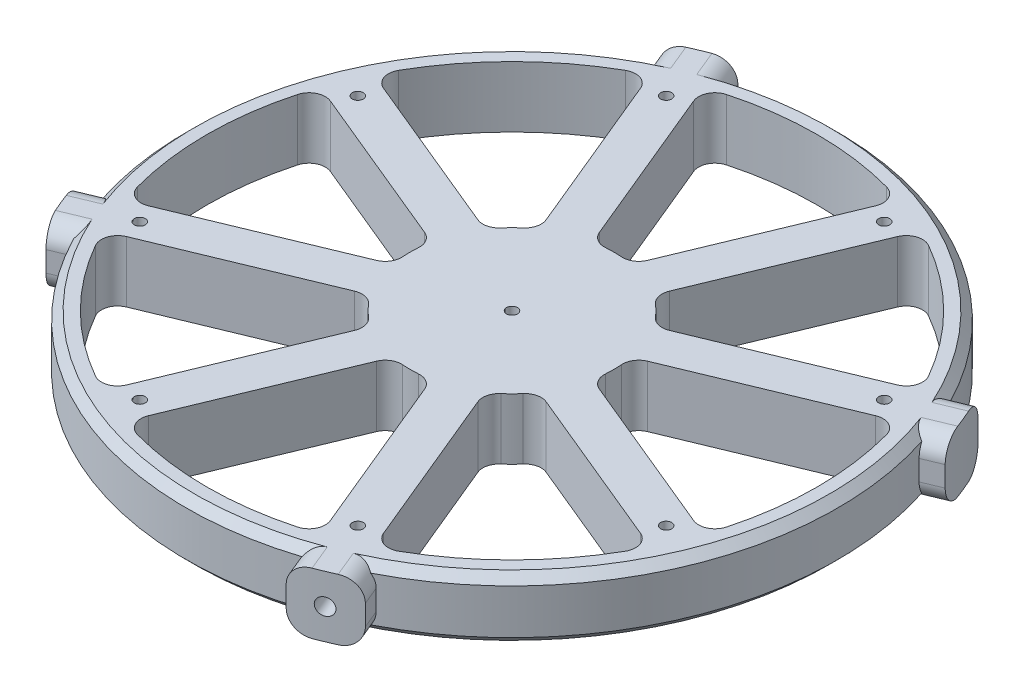
from build123d import *

# Parameters (mm, degrees)
F_6_32_TAPPED_HOLE2_D    = 2.7051
CIRPATTERN3_COUNT        = 8
CUT_EXTRUDE1_DEPTH       = 115.12688377441049
FILLET1_R                = 4
CIRPATTERN4_COUNT        = 8
FILLET1_OF_CIRPATTERN4_R = 4
F_6_32_TAPPED_HOLE1_D    = 2.7051
BOSS_EXTRUDE1_DEPTH      = 15
FILLET2_R                = 5
CIRPATTERN5_COUNT        = 4
FILLET2_OF_CIRPATTERN5_R = 5
CHAMFER1_SIZE            = 2


with BuildPart() as part:
    # Sketch2 → Revolve1 (revolve)
    with BuildSketch(Plane(origin=(0, 0, 0), x_dir=(0, 0, -1), z_dir=(1, 0, 0))):
        Polygon((0, 0), (-79.99983, -9.8e-15), (-79.99983, 14.99999999999999), (0, 14.99999999999999), align=None)
    revolve(axis=Axis((0, -0.7500000000000007, 0), (0, 1, 0)))

    # #6-32 Tapped Hole2 (through all)
    with Locations(Plane(origin=(0, 14.99999999999999, 0), x_dir=(1, 0, 0), z_dir=(0, 1, 0))):
        with Locations((-26.787840266, 64.671567276)):
            f_6_32_tapped_hole2 = Hole(F_6_32_TAPPED_HOLE2_D / 2)

    # CirPattern3: #6-32 Tapped Hole2 ×8 about axis
    cirpattern3_axis = Axis((0, -0.7500000000000007, 0), (0, 1, 0))
    for i in range(1, CIRPATTERN3_COUNT):
        add(f_6_32_tapped_hole2.rotate(cirpattern3_axis, i * 360 / CIRPATTERN3_COUNT), mode=Mode.SUBTRACT)

    # Sketch8 → Cut-Extrude1 (cut, through all)
    with BuildSketch(Plane(origin=(0, 14.99999999999999, 0), x_dir=(1, 0, 0), z_dir=(0, 1, 0))):
        with BuildLine():
            Line((-4.7543937605570585, 24.54375154636259), (-24.017942966303664, 71.05007329831746))
            ThreePointArc((-24.017942966303664, 71.05007329831746), (4.59e-15, 74.99982999999999), (24.017942966303664, 71.05007329831746))
            Line((24.017942966303664, 71.05007329831746), (4.7543937605570585, 24.54375154636259))
            ThreePointArc((4.7543937605570585, 24.54375154636259), (1.53e-15, 24.999999999999996), (-4.7543937605570585, 24.54375154636259))
        make_face()
    cut_extrude1 = extrude(amount=-CUT_EXTRUDE1_DEPTH, mode=Mode.SUBTRACT)

    # Fillet1
    fillet1_edges = [part.edges().sort_by_distance(p)[0] for p in [
        (4.754393760557059, 7.499999999999995, -24.543751546362593),
        (24.01794296630367, 7.499999999999995, -71.05007329831744),
        (-4.754393760557059, 7.499999999999995, -24.543751546362593),
        (-24.017942966303664, 7.499999999999995, -71.05007329831744),
    ]]
    fillet(fillet1_edges, radius=FILLET1_R)

    # CirPattern4: Cut-Extrude1 ×8 about axis
    cirpattern4_axis = Axis((0, -0.7500000000000007, 0), (0, 1, 0))
    for i in range(1, CIRPATTERN4_COUNT):
        add(cut_extrude1.rotate(cirpattern4_axis, i * 360 / CIRPATTERN4_COUNT), mode=Mode.SUBTRACT)

    # Fillet1 of CirPattern4
    fillet1_of_cirpattern4_edges = [part.edges().sort_by_distance(p)[0] for p in [
        (-13.99318908566989, 7.499999999999995, -20.71691722271171),
        (-33.25673829141644, 7.499999999999995, -67.22323897466659),
        (-20.716917222711707, 7.499999999999995, -13.993189085669895),
        (-67.22323897466657, 7.499999999999995, -33.256738291416454),
        (-24.543751546362593, 7.499999999999995, -4.754393760557061),
        (-71.05007329831744, 7.499999999999995, -24.017942966303675),
        (-24.543751546362593, 7.499999999999995, 4.754393760557058),
        (-71.05007329831744, 7.499999999999995, 24.01794296630366),
        (-20.71691722271171, 7.499999999999995, 13.99318908566989),
        (-67.22323897466659, 7.499999999999995, 33.25673829141644),
        (-13.993189085669895, 7.499999999999995, 20.716917222711707),
        (-33.256738291416454, 7.499999999999995, 67.22323897466657),
        (-4.754393760557062, 7.499999999999995, 24.543751546362593),
        (-24.01794296630368, 7.499999999999995, 71.05007329831744),
        (4.754393760557057, 7.499999999999995, 24.543751546362593),
        (24.017942966303657, 7.499999999999995, 71.05007329831744),
        (13.99318908566989, 7.499999999999995, 20.716917222711714),
        (33.25673829141644, 7.499999999999995, 67.2232389746666),
        (20.716917222711707, 7.499999999999995, 13.993189085669899),
        (67.22323897466657, 7.499999999999995, 33.25673829141647),
        (24.543751546362593, 7.499999999999995, 4.754393760557064),
        (71.05007329831744, 7.499999999999995, 24.017942966303686),
        (24.543751546362593, 7.499999999999995, -4.754393760557055),
        (71.05007329831744, 7.499999999999995, -24.01794296630365),
        (20.71691722271171, 7.499999999999995, -13.99318908566989),
        (67.2232389746666, 7.499999999999995, -33.25673829141643),
        (13.993189085669899, 7.499999999999995, -20.716917222711707),
        (33.25673829141647, 7.499999999999995, -67.22323897466657),
    ]]
    fillet(fillet1_of_cirpattern4_edges, radius=FILLET1_OF_CIRPATTERN4_R)

    # #6-32 Tapped Hole1 (through all)
    with Locations(Plane(origin=(0, 0, 0), x_dir=(-1, 0, 0), z_dir=(0, -1, 0))):
        with Locations((0, 0)):
            Hole(F_6_32_TAPPED_HOLE1_D / 2)

    # Sketch12 → Boss-Extrude1 (add)
    with BuildSketch(Plane(origin=(0, 14.99999999999999, 0), x_dir=(1, 0, 0), z_dir=(0, 1, 0))):
        with BuildLine():
            Line((-23.598668372771456, 76.44001341614779), (-25.473817191360403, 80.96702312545311))
            ThreePointArc((-25.473817191360403, 80.96702312545311), (-32.48207910891059, 78.41867591880764), (-39.2396222257786, 75.26503998321326))
            Line((-39.2396222257786, 75.26503998321326), (-37.36447340718965, 70.73803027390794))
            ThreePointArc((-37.36447340718965, 70.73803027390794), (-30.61460953302372, 73.91020554138238), (-23.598668372771456, 76.44001341614779))
        make_face()
    boss_extrude1 = extrude(amount=-BOSS_EXTRUDE1_DEPTH)

    # Fillet2
    fillet2_edges = [part.edges().sort_by_distance(p)[0] for p in [
        (-24.53624278206593, 14.99999999999999, -78.70351827080046),
        (-38.30204781648412, 14.99999999999999, -73.00153512856059),
        (-24.53624278206593, -1.066e-14, -78.70351827080046),
        (-38.30204781648412, -1.066e-14, -73.00153512856059),
    ]]
    fillet(fillet2_edges, radius=FILLET2_R)

    # CirPattern5: Boss-Extrude1 ×4 about axis
    cirpattern5_axis = Axis((0, -0.7500000000000007, 0), (0, 1, 0))
    for i in range(1, CIRPATTERN5_COUNT):
        add(boss_extrude1.rotate(cirpattern5_axis, i * 360 / CIRPATTERN5_COUNT))

    # Fillet2 of CirPattern5
    fillet2_of_cirpattern5_edges = [part.edges().sort_by_distance(p)[0] for p in [
        (-78.70351827080046, 14.99999999999999, 24.536242782065926),
        (-73.00153512856059, 14.99999999999999, 38.30204781648411),
        (-78.70351827080046, -1.066e-14, 24.536242782065926),
        (-73.00153512856059, -1.066e-14, 38.30204781648411),
        (24.53624278206592, 14.99999999999999, 78.70351827080046),
        (38.30204781648411, 14.99999999999999, 73.00153512856059),
        (24.53624278206592, -1.066e-14, 78.70351827080046),
        (38.30204781648411, -1.066e-14, 73.00153512856059),
        (78.70351827080046, 14.99999999999999, -24.536242782065916),
        (73.00153512856059, 14.99999999999999, -38.302047816484105),
        (78.70351827080046, -1.066e-14, -24.536242782065916),
        (73.00153512856059, -1.066e-14, -38.302047816484105),
    ]]
    fillet(fillet2_of_cirpattern5_edges, radius=FILLET2_OF_CIRPATTERN5_R)

    # Chamfer1
    chamfer1_edges = [part.edges().sort_by_distance(p)[0] for p in [
        (73.91020554138242, 9.06e-15, 30.614609533023646),
        (-30.614609533023643, 2.717e-14, 73.91020554138242),
        (-73.91020554138242, 2.717e-14, -30.614609533023643),
        (-73.91020554138242, 14.99999999999999, -30.614609533023643),
        (-30.614609533023643, 14.99999999999999, 73.91020554138242),
        (73.91020554138242, 14.99999999999999, 30.614609533023646),
        (30.614609533023657, 9.06e-15, -73.91020554138244),
        (30.614609533023657, 14.99999999999999, -73.91020554138244),
    ]]
    chamfer(chamfer1_edges, length=CHAMFER1_SIZE)

    # Sketch15 → #20 (0.161) Diameter Hole1 (revolve, cut)
    with BuildSketch(Plane(origin=(0, 7.5, 0), x_dir=(-0.9238795325112864, 0, 0.38268343236509056), z_dir=(0, 1, 0))):
        Polygon((0, 0), (-2.6e-14, 106.1589018618328), (2.044699999999976, 106.1589018618328), (2.0446999999999877, -1.3e-15), align=None)
    revolve(axis=Axis((-2.4300397955183217, 7.5, -5.866635031446661), (0.38268343236509056, 0, 0.9238795325112865)), mode=Mode.SUBTRACT)


solid = part.part
